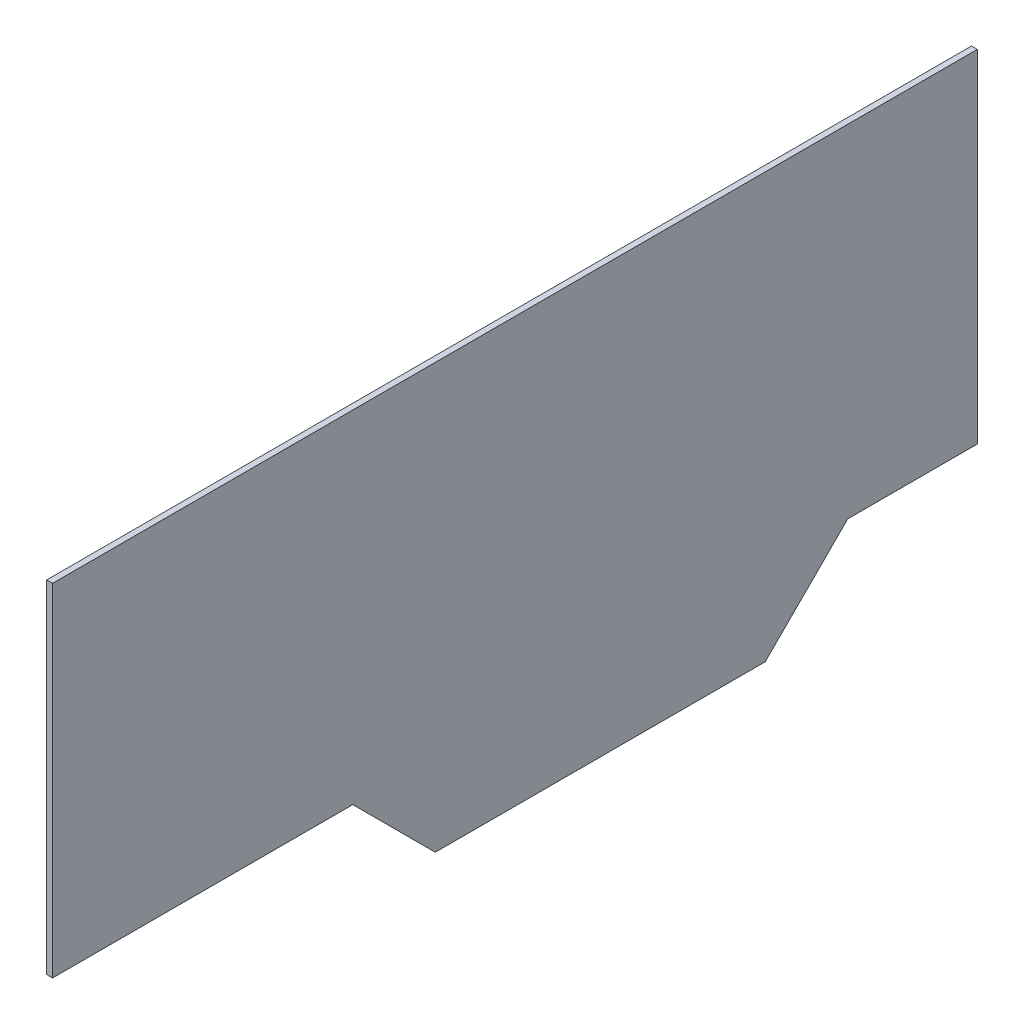
from build123d import *

# Parameters (mm, degrees)
SKETCH1_W           = 498.348
SKETCH1_H           = 177.8
BOSS_EXTRUDE1_DEPTH = 1.5875
BOSS_EXTRUDE2_DEPTH = 3.175


with BuildPart() as part:
    # Sketch1 → Boss-Extrude1 (new, symmetric)
    with BuildSketch(Plane(origin=(0, 0, 0), x_dir=(0, 0, -1), z_dir=(1, 0, 0))):
        Rectangle(SKETCH1_W, SKETCH1_H)
    extrude(amount=BOSS_EXTRUDE1_DEPTH, both=True)

    # Sketch2 → Boss-Extrude2 (add)
    with BuildSketch(Plane(origin=(1.5875, 0, 0), x_dir=(0, 0, -1), z_dir=(1, 0, 0))):
        Polygon((249.174, -95.25), (249.174, -88.9), (-249.174, -88.9), (-249.174, -95.25), (-87.376, -95.25), (-42.926, -139.7), (134.874, -139.7), (179.324, -95.25), align=None)
    extrude(amount=-BOSS_EXTRUDE2_DEPTH)


solid = part.part
